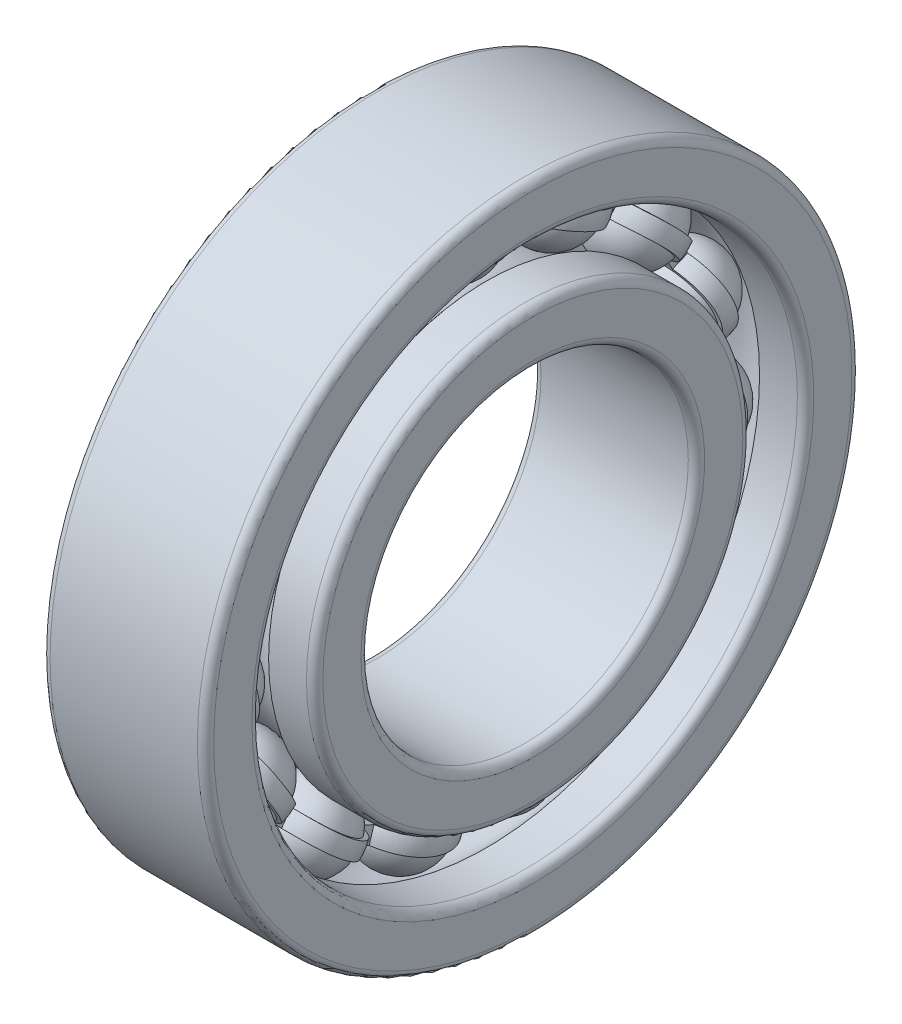
from build123d import *

# Parameters (mm, degrees)
SKETCH_5_W               = 0.6
SKETCH_5_H               = 0.3999999999999986
PATTERN_CIRCULAR_5_COUNT = 15
PATTERN_CIRCULAR_2_COUNT = 15


with BuildPart() as part:
    # 草图2 → 旋转1 (revolve)
    with BuildSketch(Plane.XY):
        with BuildLine():
            Line((1.8000000000000025, 4), (-1.7999999999999985, 4))
            ThreePointArc((-1.7999999999999985, 4), (-1.9414213562373075, 4.05857864376269), (-1.9999999999999978, 4.199999999999999))
            Line((-1.9999999999999978, 4.199999999999999), (-1.9999999999999978, 5.133333333333334))
            ThreePointArc((-1.9999999999999978, 5.133333333333334), (-1.9414213562373068, 5.274754689570642), (-1.7999999999999983, 5.333333333333332))
            Line((-1.7999999999999983, 5.333333333333332), (-0.7453559924999261, 5.333333333333332))
            ThreePointArc((-0.7453559924999261, 5.333333333333332), (1.05e-15, 5), (0.7453559924999261, 5.333333333333332))
            Line((0.7453559924999261, 5.333333333333332), (1.8000000000000018, 5.333333333333332))
            ThreePointArc((1.8000000000000018, 5.333333333333332), (1.9414213562373117, 5.274754689570643), (2.000000000000002, 5.133333333333333))
            Line((2.000000000000002, 5.133333333333333), (2.0000000000000027, 4.2))
            ThreePointArc((2.0000000000000027, 4.2), (1.9414213562373122, 4.058578643762691), (1.8000000000000025, 4))
        make_face()
        with BuildLine():
            Line((-1.9999999999999967, 7.800000000000002), (-1.9999999999999973, 6.866666666666667))
            ThreePointArc((-1.9999999999999973, 6.866666666666667), (-1.941421356237307, 6.725245310429358), (-1.799999999999998, 6.666666666666667))
            Line((-1.799999999999998, 6.666666666666667), (-0.7453559924999275, 6.666666666666666))
            ThreePointArc((-0.7453559924999275, 6.666666666666666), (1.05e-15, 6.999999999999996), (0.7453559924999275, 6.666666666666666))
            Line((0.7453559924999275, 6.666666666666666), (1.800000000000002, 6.666666666666666))
            ThreePointArc((1.800000000000002, 6.666666666666666), (1.9414213562373124, 6.725245310429357), (2.0000000000000027, 6.866666666666667))
            Line((2.0000000000000027, 6.866666666666667), (2.000000000000001, 7.800000000000002))
            ThreePointArc((2.000000000000001, 7.800000000000002), (1.9414213562373106, 7.94142135623731), (1.8000000000000018, 8))
            Line((1.8000000000000018, 8), (-1.7999999999999985, 8))
            ThreePointArc((-1.7999999999999985, 8), (-1.9414213562373066, 7.94142135623731), (-1.9999999999999967, 7.800000000000002))
        make_face()
    revolve(axis=Axis((-3.4999999999999996, 0, 0), (1, 0, 0)))


with BuildPart() as body_2:
    # 草图5 → 旋转3 (revolve)
    with BuildSketch(Plane.XY):
        with Locations((2.44e-15, 6.000000000000001)):
            Rectangle(SKETCH_5_W, SKETCH_5_H)
    revolve(axis=Axis((-19.927092192426834, 0, 0), (1, 0, 0)))



with BuildPart() as body_3:
    # 草图3 → 旋转2 (revolve)
    with BuildSketch(Plane.XY):
        with BuildLine():
            ThreePointArc((1.099999999999997, 6), (9e-17, 7.099999999999994), (-1.099999999999997, 6))
            Line((-1.099999999999997, 6), (1.099999999999997, 6))
        make_face()
    revolve(axis=Axis((-1.099999999999997, 6, 0), (1, 0, 0)))


with BuildPart() as pattern_circular_5_1:
    # 阵列(圆周)5: pattern copy
    add(body_3.part.rotate(Axis((-3.850000000000002, 0, 0), (1, 0, 0)), 1 * 360 / PATTERN_CIRCULAR_5_COUNT))


with BuildPart() as pattern_circular_5_2:
    # 阵列(圆周)5: pattern copy
    add(body_3.part.rotate(Axis((-3.850000000000002, 0, 0), (1, 0, 0)), 2 * 360 / PATTERN_CIRCULAR_5_COUNT))


with BuildPart() as pattern_circular_5_3:
    # 阵列(圆周)5: pattern copy
    add(body_3.part.rotate(Axis((-3.850000000000002, 0, 0), (1, 0, 0)), 3 * 360 / PATTERN_CIRCULAR_5_COUNT))


with BuildPart() as pattern_circular_5_4:
    # 阵列(圆周)5: pattern copy
    add(body_3.part.rotate(Axis((-3.850000000000002, 0, 0), (1, 0, 0)), 4 * 360 / PATTERN_CIRCULAR_5_COUNT))


with BuildPart() as pattern_circular_5_5:
    # 阵列(圆周)5: pattern copy
    add(body_3.part.rotate(Axis((-3.850000000000002, 0, 0), (1, 0, 0)), 5 * 360 / PATTERN_CIRCULAR_5_COUNT))


with BuildPart() as pattern_circular_5_6:
    # 阵列(圆周)5: pattern copy
    add(body_3.part.rotate(Axis((-3.850000000000002, 0, 0), (1, 0, 0)), 6 * 360 / PATTERN_CIRCULAR_5_COUNT))


with BuildPart() as pattern_circular_5_7:
    # 阵列(圆周)5: pattern copy
    add(body_3.part.rotate(Axis((-3.850000000000002, 0, 0), (1, 0, 0)), 7 * 360 / PATTERN_CIRCULAR_5_COUNT))


with BuildPart() as pattern_circular_5_8:
    # 阵列(圆周)5: pattern copy
    add(body_3.part.rotate(Axis((-3.850000000000002, 0, 0), (1, 0, 0)), 8 * 360 / PATTERN_CIRCULAR_5_COUNT))


with BuildPart() as pattern_circular_5_9:
    # 阵列(圆周)5: pattern copy
    add(body_3.part.rotate(Axis((-3.850000000000002, 0, 0), (1, 0, 0)), 9 * 360 / PATTERN_CIRCULAR_5_COUNT))


with BuildPart() as pattern_circular_5_10:
    # 阵列(圆周)5: pattern copy
    add(body_3.part.rotate(Axis((-3.850000000000002, 0, 0), (1, 0, 0)), 10 * 360 / PATTERN_CIRCULAR_5_COUNT))


with BuildPart() as pattern_circular_5_11:
    # 阵列(圆周)5: pattern copy
    add(body_3.part.rotate(Axis((-3.850000000000002, 0, 0), (1, 0, 0)), 11 * 360 / PATTERN_CIRCULAR_5_COUNT))


with BuildPart() as pattern_circular_5_12:
    # 阵列(圆周)5: pattern copy
    add(body_3.part.rotate(Axis((-3.850000000000002, 0, 0), (1, 0, 0)), 12 * 360 / PATTERN_CIRCULAR_5_COUNT))


with BuildPart() as pattern_circular_5_13:
    # 阵列(圆周)5: pattern copy
    add(body_3.part.rotate(Axis((-3.850000000000002, 0, 0), (1, 0, 0)), 13 * 360 / PATTERN_CIRCULAR_5_COUNT))


with BuildPart() as pattern_circular_5_14:
    # 阵列(圆周)5: pattern copy
    add(body_3.part.rotate(Axis((-3.850000000000002, 0, 0), (1, 0, 0)), 14 * 360 / PATTERN_CIRCULAR_5_COUNT))


with BuildPart() as cut_revolve_1_tool:
    # 草图6 → 切除-旋转1 (revolve)
    with BuildSketch(Plane.XY):
        with BuildLine():
            Line((-1.081665382639194, 6.199999999999999), (1.081665382639194, 6.199999999999999))
            ThreePointArc((1.081665382639194, 6.199999999999999), (2.1e-15, 7.099999999999994), (-1.081665382639194, 6.199999999999999))
        make_face()
        with BuildLine():
            Line((-1.081665382639194, 5.800000000000002), (1.081665382639194, 5.800000000000002))
            ThreePointArc((1.081665382639194, 5.800000000000002), (2.35e-15, 4.9), (-1.081665382639194, 5.800000000000002))
        make_face()
    revolve(axis=Axis((-19.927092192426834, 0, 0), (1, 0, 0)))


with BuildPart() as part_1:
    add(part.part)

    # 切除-旋转1: cut by cut_revolve_1_tool
    add(cut_revolve_1_tool.part, mode=Mode.SUBTRACT)


with BuildPart() as body_3_1:
    add(body_3.part)

    # 切除-旋转1: cut by cut_revolve_1_tool
    add(cut_revolve_1_tool.part, mode=Mode.SUBTRACT)


with BuildPart() as pattern_circular_5_1_1:
    add(pattern_circular_5_1.part)

    # 切除-旋转1: cut by cut_revolve_1_tool
    add(cut_revolve_1_tool.part, mode=Mode.SUBTRACT)


with BuildPart() as pattern_circular_5_2_1:
    add(pattern_circular_5_2.part)

    # 切除-旋转1: cut by cut_revolve_1_tool
    add(cut_revolve_1_tool.part, mode=Mode.SUBTRACT)


with BuildPart() as pattern_circular_5_3_1:
    add(pattern_circular_5_3.part)

    # 切除-旋转1: cut by cut_revolve_1_tool
    add(cut_revolve_1_tool.part, mode=Mode.SUBTRACT)


with BuildPart() as pattern_circular_5_4_1:
    add(pattern_circular_5_4.part)

    # 切除-旋转1: cut by cut_revolve_1_tool
    add(cut_revolve_1_tool.part, mode=Mode.SUBTRACT)


with BuildPart() as pattern_circular_5_5_1:
    add(pattern_circular_5_5.part)

    # 切除-旋转1: cut by cut_revolve_1_tool
    add(cut_revolve_1_tool.part, mode=Mode.SUBTRACT)


with BuildPart() as pattern_circular_5_6_1:
    add(pattern_circular_5_6.part)

    # 切除-旋转1: cut by cut_revolve_1_tool
    add(cut_revolve_1_tool.part, mode=Mode.SUBTRACT)


with BuildPart() as pattern_circular_5_7_1:
    add(pattern_circular_5_7.part)

    # 切除-旋转1: cut by cut_revolve_1_tool
    add(cut_revolve_1_tool.part, mode=Mode.SUBTRACT)


with BuildPart() as pattern_circular_5_8_1:
    add(pattern_circular_5_8.part)

    # 切除-旋转1: cut by cut_revolve_1_tool
    add(cut_revolve_1_tool.part, mode=Mode.SUBTRACT)


with BuildPart() as pattern_circular_5_9_1:
    add(pattern_circular_5_9.part)

    # 切除-旋转1: cut by cut_revolve_1_tool
    add(cut_revolve_1_tool.part, mode=Mode.SUBTRACT)


with BuildPart() as pattern_circular_5_10_1:
    add(pattern_circular_5_10.part)

    # 切除-旋转1: cut by cut_revolve_1_tool
    add(cut_revolve_1_tool.part, mode=Mode.SUBTRACT)


with BuildPart() as pattern_circular_5_11_1:
    add(pattern_circular_5_11.part)

    # 切除-旋转1: cut by cut_revolve_1_tool
    add(cut_revolve_1_tool.part, mode=Mode.SUBTRACT)


with BuildPart() as pattern_circular_5_12_1:
    add(pattern_circular_5_12.part)

    # 切除-旋转1: cut by cut_revolve_1_tool
    add(cut_revolve_1_tool.part, mode=Mode.SUBTRACT)


with BuildPart() as pattern_circular_5_13_1:
    add(pattern_circular_5_13.part)

    # 切除-旋转1: cut by cut_revolve_1_tool
    add(cut_revolve_1_tool.part, mode=Mode.SUBTRACT)


with BuildPart() as pattern_circular_5_14_1:
    add(pattern_circular_5_14.part)

    # 切除-旋转1: cut by cut_revolve_1_tool
    add(cut_revolve_1_tool.part, mode=Mode.SUBTRACT)


with BuildPart() as body_2_1:
    add(body_2.part)

    add(body_3_1.part)  # 旋转4 merges body 3
    # 草图7 → 旋转4 (revolve)
    with BuildSketch(Plane.XY):
        with BuildLine():
            Line((-0.9999999999999972, 6), (0.9999999999999972, 6))
            ThreePointArc((0.9999999999999972, 6), (2.83e-15, 6.999999999999995), (-0.9999999999999972, 6))
        make_face()
    revolve_4 = revolve(axis=Axis((-0.9999999999999972, 6, 0), (1, 0, 0)))

    # 阵列(圆周)2: 旋转4 ×15 about axis
    pattern_circular_2_axis = Axis((-3.850000000000002, 0, 0), (1, 0, 0))
    for i in range(1, PATTERN_CIRCULAR_2_COUNT):
        add(revolve_4.rotate(pattern_circular_2_axis, i * 360 / PATTERN_CIRCULAR_2_COUNT))


solid = Compound([part_1.part, pattern_circular_5_1_1.part, pattern_circular_5_2_1.part, pattern_circular_5_3_1.part, pattern_circular_5_4_1.part, pattern_circular_5_5_1.part, pattern_circular_5_6_1.part, pattern_circular_5_7_1.part, pattern_circular_5_8_1.part, pattern_circular_5_9_1.part, pattern_circular_5_10_1.part, pattern_circular_5_11_1.part, pattern_circular_5_12_1.part, pattern_circular_5_13_1.part, pattern_circular_5_14_1.part, body_2_1.part])
